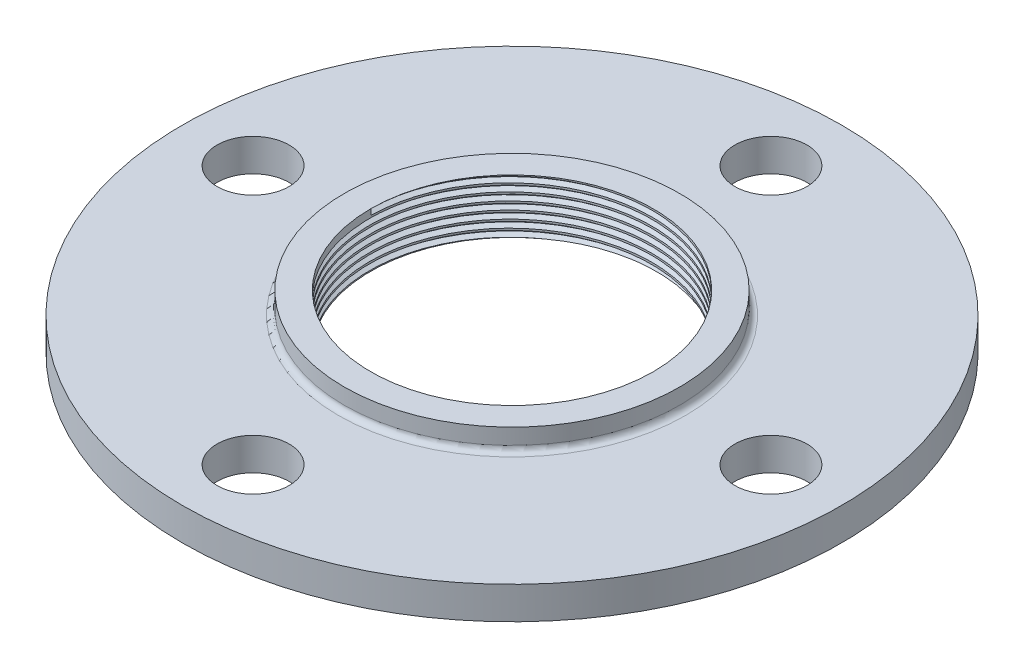
from build123d import *

# Parameters (mm, degrees)
SKETCH1_R           = 88.9
SKETCH1_R_2         = 9.7234375
BOSS_EXTRUDE1_DEPTH = 8.763
SKETCH2_R           = 45.24375
SKETCH2_R_2         = 38.1
BOSS_EXTRUDE2_DEPTH = 5.842
FILLET1_R           = 1.5875
SKETCH3_R           = 38.1
CUT_EXTRUDE1_DEPTH  = 127.028608534
THREAD1_PITCH       = 2.116666667


with BuildPart() as part:
    # Sketch1 → Boss-Extrude1 (new body)
    with BuildSketch(Plane(origin=(0, 0, 0), x_dir=(1, 0, 0), z_dir=(0, 1, 0))):
        with Locations(Location((0, 0, 0), (0, 0, 270))):
            Circle(SKETCH1_R)
        with Locations(Location((0, 69.85, 0), (0, 0, 270))):
            Circle(SKETCH1_R_2, mode=Mode.SUBTRACT)
        with Locations(Location((69.85, 0, 0), (0, 0, 270))):
            Circle(SKETCH1_R_2, mode=Mode.SUBTRACT)
        with Locations(Location((0, -69.85, 0), (0, 0, 270))):
            Circle(SKETCH1_R_2, mode=Mode.SUBTRACT)
        with Locations(Location((-69.85, 0, 0), (0, 0, 270))):
            Circle(SKETCH1_R_2, mode=Mode.SUBTRACT)
    extrude(amount=BOSS_EXTRUDE1_DEPTH)

    # Sketch2 → Boss-Extrude2 (add)
    with BuildSketch(Plane(origin=(0, 8.763, 0), x_dir=(1, 0, 0), z_dir=(0, 1, 0))):
        with Locations(Location((0, 0, 0), (0, 0, 270))):
            Circle(SKETCH2_R)
        with Locations(Location((0, 0, 0), (0, 0, 270))):
            Circle(SKETCH2_R_2, mode=Mode.SUBTRACT)
    extrude(amount=BOSS_EXTRUDE2_DEPTH)

    # Fillet1
    fillet1_edges = [part.edges().sort_by_distance(p)[0] for p in [
        (0, 8.763, -45.24375),
    ]]
    fillet(fillet1_edges, radius=FILLET1_R)

    # Sketch3 → Cut-Extrude1 (cut, through all)
    with BuildSketch(Plane(origin=(0, 8.763, 0), x_dir=(1, 0, 0), z_dir=(0, 1, 0))):
        with Locations(Location((0, 0, 0), (0, 0, 270))):
            Circle(SKETCH3_R)
    extrude(amount=-CUT_EXTRUDE1_DEPTH, mode=Mode.SUBTRACT)

    # Thread1: the profile of Thread Profile1 profile screwed along a right-hand helix of 6.9 turns, 10 arcs to a turn; built about Z, then put on its axis
    thread1_z = Axis((0, 0, 0), (0, 0, 1))
    thread1_corners = [(38.0997, 0, -0.000173205), (39.245679435, 0, 0.66145833), (39.245679435, 0, 0.926041664), (38.0997, 0, 1.587673199)]
    with BuildLine(mode=Mode.PRIVATE) as thread1_profile:
        Line(thread1_corners[0], thread1_corners[1])
        Line(thread1_corners[1], thread1_corners[2])
        Line(thread1_corners[2], thread1_corners[3])
        Line(thread1_corners[3], thread1_corners[0])
    thread1_cap = Face(thread1_profile.wire())
    thread1_turn_angles = [0, 18, 36, 54, 72, 90, 108, 126, 144, 162, 180, 198, 216, 234, 252, 270, 288, 306, 324, 342, 360]
    thread1_turn_weights = [1, 0.9510565162951535, 1, 0.9510565162951535, 1, 0.9510565162951535, 1, 0.9510565162951535, 1, 0.9510565162951535, 1, 0.9510565162951535, 1, 0.9510565162951535, 1, 0.9510565162951535, 1, 0.9510565162951535, 1, 0.9510565162951535, 1]
    thread1_turn_rails = [Edge.make_bspline([Vector(p[0], p[1], 0).rotate(thread1_z, thread1_turn_angles[k]) / thread1_turn_weights[k] + Vector(0, 0, p[2] + THREAD1_PITCH * thread1_turn_angles[k] / 360) for k in range(21)], [0, 0, 0, 1, 1, 2, 2, 3, 3, 4, 4, 5, 5, 6, 6, 7, 7, 8, 8, 9, 9, 10, 10, 10], 2, thread1_turn_weights) for p in thread1_corners]
    thread1_turn_sides = [Face.make_surface_from_curves(thread1_turn_rails[p[0]], thread1_turn_rails[p[1]]) for p in [(0, 1), (1, 2), (2, 3), (3, 0)]]
    thread1_last_angles = [2160, 2178, 2196, 2214, 2232, 2250, 2268, 2286, 2304, 2322, 2340, 2358, 2376, 2394, 2412, 2430, 2448, 2466, 2484]
    thread1_last_weights = [1, 0.9510565162951535, 1, 0.9510565162951535, 1, 0.9510565162951535, 1, 0.9510565162951535, 1, 0.9510565162951535, 1, 0.9510565162951535, 1, 0.9510565162951535, 1, 0.9510565162951535, 1, 0.9510565162951535, 1]
    thread1_last_rails = [Edge.make_bspline([Vector(p[0], p[1], 0).rotate(thread1_z, thread1_last_angles[k]) / thread1_last_weights[k] + Vector(0, 0, p[2] + THREAD1_PITCH * thread1_last_angles[k] / 360) for k in range(19)], [0, 0, 0, 1, 1, 2, 2, 3, 3, 4, 4, 5, 5, 6, 6, 7, 7, 8, 8, 9, 9, 9], 2, thread1_last_weights) for p in thread1_corners]
    thread1_last_sides = [Face.make_surface_from_curves(thread1_last_rails[p[0]], thread1_last_rails[p[1]]) for p in [(0, 1), (1, 2), (2, 3), (3, 0)]]
    thread1 = Plane(origin=(0, 14.605, 0), x_dir=(-1, 0, 0), z_dir=(0, -1, 0)) * Solid(Shell([*[p.moved(Location((0, 0, THREAD1_PITCH * i))) for i in range(6) for p in thread1_turn_sides], *thread1_last_sides, thread1_cap, thread1_cap.rotate(thread1_z, 2484).moved(Location((0, 0, THREAD1_PITCH * 2484 / 360)))]))
    add(thread1, mode=Mode.SUBTRACT)


solid = part.part
